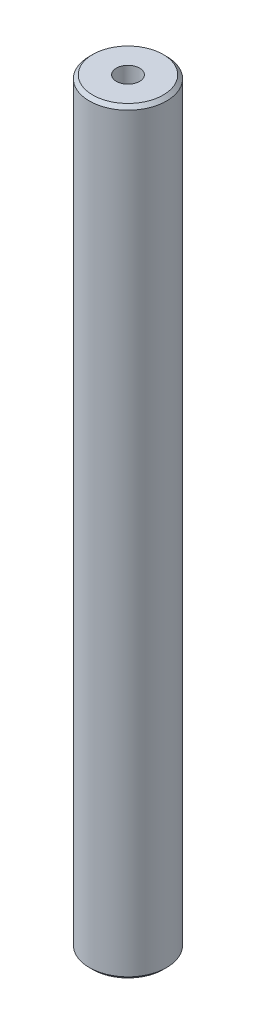
from build123d import *

# Parameters (mm, degrees)
SKETCH1_R           = 17.5
BOSS_EXTRUDE1_DEPTH = 343.058098374
SKETCH2_R           = 5.251806824
CUT_EXTRUDE1_DEPTH  = 344.94964582
CHAMFER1_SIZE       = 1.554526585


with BuildPart() as part:
    # Sketch1 → Boss-Extrude1 (new body)
    with BuildSketch(Plane(origin=(0, 0, 0), x_dir=(1, 0, 0), z_dir=(0, 1, 0))):
        Circle(SKETCH1_R)
    extrude(amount=BOSS_EXTRUDE1_DEPTH)

    # Sketch2 → Cut-Extrude1 (cut, through all)
    with BuildSketch(Plane(origin=(0, 0, 0), x_dir=(1, 0, 0), z_dir=(0, 1, 0))):
        Circle(SKETCH2_R)
    extrude(amount=CUT_EXTRUDE1_DEPTH, mode=Mode.SUBTRACT)

    # Chamfer1
    chamfer1_edges = [part.edges().sort_by_distance(p)[0] for p in [
        (-17.5, 343.058098374, 0),
        (-17.5, 0, 0),
    ]]
    chamfer(chamfer1_edges, length=CHAMFER1_SIZE)


solid = part.part
